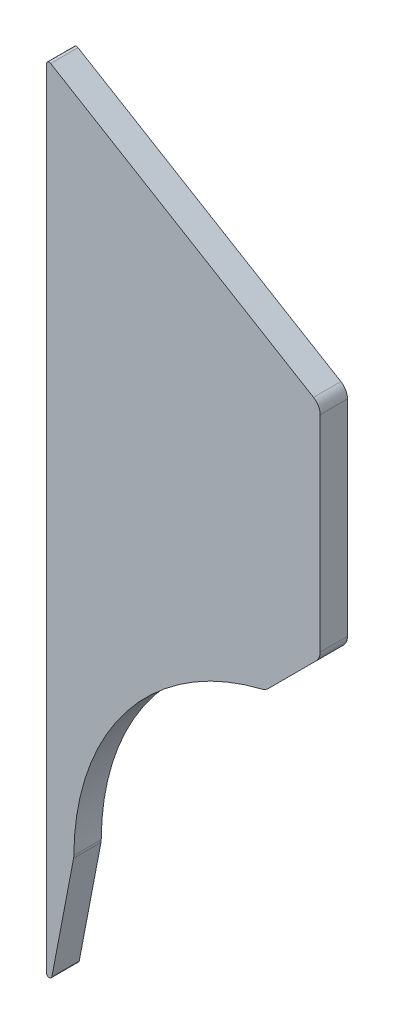
from build123d import *

# Parameters (mm, degrees)
BOSS_EXTRUDE1_DEPTH = 10


with BuildPart() as part:
    # Sketch1 → Boss-Extrude1 (new body)
    with BuildSketch(Plane.XY):
        with BuildLine():
            Line((1.514495755, 99.091302547), (97.572478777, 41.456512734))
            ThreePointArc((97.572478777, 41.456512734), (99.350999534, 39.63254218), (100, 37.169048105))
            Line((100, 37.169048105), (100, -37.928932188))
            ThreePointArc((100, -37.928932188), (99.619397663, -39.84234935), (98.535533906, -41.464466094))
            Line((98.535533906, -41.464466094), (81.004269823, -58.995730177))
            ThreePointArc((81.004269823, -58.995730177), (79.920199373, -59.817985495), (78.654591921, -60.317535619))
            ThreePointArc((78.654591921, -60.317535619), (29.355604904, -91.987923657), (10.00115127, -147.294421683))
            ThreePointArc((10.00115127, -147.294421683), (9.977672992, -147.753763522), (9.912084694, -148.209004479))
            Line((9.912084694, -148.209004479), (1.982173893, -189.643070819))
            ThreePointArc((1.982173893, -189.643070819), (0.90559103, -190.450629734), (0, -189.455096236))
            Line((0, -189.455096236), (0, 98.233809621))
            ThreePointArc((0, 98.233809621), (0.507301185, 99.104009528), (1.514495755, 99.091302547))
        make_face()
    extrude(amount=BOSS_EXTRUDE1_DEPTH)


solid = part.part
